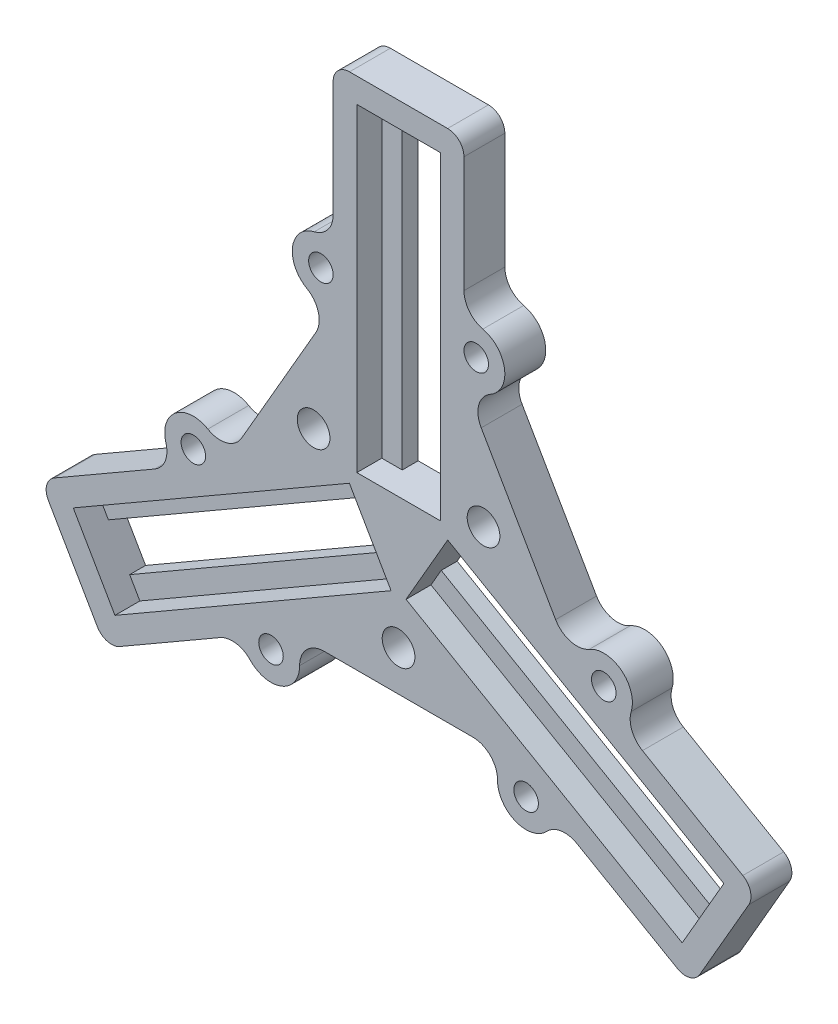
from build123d import *

# Parameters (mm, degrees)
SKETCH1_W           = 5.2
SKETCH1_H           = 39
BOSS_EXTRUDE1_DEPTH = 5
SKETCH2_W           = 10.2
SKETCH2_H           = 39
CUT_EXTRUDE1_DEPTH  = 3.05
CUT_EXTRUDE2_REACH  = 65.739
SKETCH3_R           = 2
SKETCH4_R           = 3.5
SKETCH4_R_2         = 1.5
BOSS_EXTRUDE2_DEPTH = 5
FILLET1_R           = 3
FILLET2_R           = 3
FILLET3_R           = 2


with BuildPart() as part:
    # Sketch1 → Boss-Extrude1 (new body)
    with BuildSketch(Plane.XY):
        Polygon((-8, 46), (8, 46), (8, 20), (21.320508076, -3.07179677), (43.837168574, -16.07179677), (35.837168574, -29.92820323), (13.320508076, -16.92820323), (-13.320508076, -16.92820323), (-35.837168574, -29.92820323), (-43.837168574, -16.07179677), (-21.320508076, -3.07179677), (-8, 20), align=None)
        Polygon((4.764101615, 0.25166605), (2.164101615, -4.25166605), (35.939092363, -23.75166605), (38.539092363, -19.24833395), align=None, mode=Mode.SUBTRACT)
        with Locations((0, 23.5)):
            Rectangle(SKETCH1_W, SKETCH1_H, mode=Mode.SUBTRACT)
        Polygon((-2.164101615, -4.25166605), (-4.764101615, 0.25166605), (-38.539092363, -19.24833395), (-35.939092363, -23.75166605), align=None, mode=Mode.SUBTRACT)
    extrude(amount=BOSS_EXTRUDE1_DEPTH)

    # Sketch2 → Cut-Extrude1 (cut)
    with BuildSketch(Plane.XY.offset(5)):
        with Locations((0, 23.5)):
            Rectangle(SKETCH2_W, SKETCH2_H)
        Polygon((39.789092363, -17.083270441), (34.689092363, -25.916729559), (0.914101615, -6.416729559), (6.014101615, 2.416729559), align=None)
        Polygon((-34.689092363, -25.916729559), (-39.789092363, -17.083270441), (-6.014101615, 2.416729559), (-0.914101615, -6.416729559), align=None)
    extrude(amount=-CUT_EXTRUDE1_DEPTH, mode=Mode.SUBTRACT)

    # Sketch3 → Cut-Extrude2 (cut, up to next)
    with BuildSketch(Plane.XY.offset(5), mode=Mode.PRIVATE) as cut_extrude2_sk1:
        with Locations((0, -12)):
            Circle(SKETCH3_R)
    cut_extrude2_tool1 = extrude(cut_extrude2_sk1.sketch, amount=-CUT_EXTRUDE2_REACH, mode=Mode.PRIVATE) & part.part
    # Sketch3 → Cut-Extrude2 (cut, up to next)
    with BuildSketch(Plane.XY.offset(5), mode=Mode.PRIVATE) as cut_extrude2_sk2:
        with Locations((-10.392304845, 6)):
            Circle(SKETCH3_R)
    cut_extrude2_tool2 = extrude(cut_extrude2_sk2.sketch, amount=-CUT_EXTRUDE2_REACH, mode=Mode.PRIVATE) & part.part
    # Sketch3 → Cut-Extrude2 (cut, up to next)
    with BuildSketch(Plane.XY.offset(5), mode=Mode.PRIVATE) as cut_extrude2_sk3:
        with Locations((10.392304845, 6)):
            Circle(SKETCH3_R)
    cut_extrude2_tool3 = extrude(cut_extrude2_sk3.sketch, amount=-CUT_EXTRUDE2_REACH, mode=Mode.PRIVATE) & part.part
    add(cut_extrude2_tool1.solids().sort_by_distance((0, -12, 5))[0], mode=Mode.SUBTRACT)
    add(cut_extrude2_tool2.solids().sort_by_distance((-10.392305, 6, 5))[0], mode=Mode.SUBTRACT)
    add(cut_extrude2_tool3.solids().sort_by_distance((10.392305, 6, 5))[0], mode=Mode.SUBTRACT)

    # Sketch4 → Boss-Extrude2 (add)
    # profile 1 of 6: a face of its own
    with BuildSketch(Plane.XY.offset(5)):
        with Locations((9.5, 23.5)):
            Circle(SKETCH4_R)
        with Locations((9.5, 23.5)):
            Circle(SKETCH4_R_2, mode=Mode.SUBTRACT)
    # profile 2 of 6: a face of its own
    with BuildSketch(Plane.XY.offset(5)):
        with Locations((-9.5, 23.5)):
            Circle(SKETCH4_R)
        with Locations((-9.5, 23.5)):
            Circle(SKETCH4_R_2, mode=Mode.SUBTRACT)
    # profile 3 of 6: a face of its own
    with BuildSketch(Plane.XY.offset(5)):
        with Locations((25.101596989, -3.522758664)):
            Circle(SKETCH4_R)
        with Locations((25.101596989, -3.522758664)):
            Circle(SKETCH4_R_2, mode=Mode.SUBTRACT)
    # profile 4 of 6: a face of its own
    with BuildSketch(Plane.XY.offset(5)):
        with Locations((15.601596989, -19.977241336)):
            Circle(SKETCH4_R)
        with Locations((15.601596989, -19.977241336)):
            Circle(SKETCH4_R_2, mode=Mode.SUBTRACT)
    # profile 5 of 6: a face of its own
    with BuildSketch(Plane.XY.offset(5)):
        with Locations((-15.601596989, -19.977241336)):
            Circle(SKETCH4_R)
        with Locations((-15.601596989, -19.977241336)):
            Circle(SKETCH4_R_2, mode=Mode.SUBTRACT)
    # profile 6 of 6: a face of its own
    with BuildSketch(Plane.XY.offset(5)):
        with Locations((-25.101596989, -3.522758664)):
            Circle(SKETCH4_R)
        with Locations((-25.101596989, -3.522758664)):
            Circle(SKETCH4_R_2, mode=Mode.SUBTRACT)
    extrude(amount=-BOSS_EXTRUDE2_DEPTH)

    # Fillet1
    # the kernel refuses this fillet: 3 mm, written as the material it adds along each edge
    with BuildSketch(Plane(origin=(8, 26.66227766, 0), x_dir=(0.9944903161976937, 0.10482848367219241, 0), z_dir=(0, 0, 1)), Plane(origin=(19.090209776, -20.25934206, 0), x_dir=(-0.40646102819849994, -0.9136681194809295, 0), z_dir=(0, 0, 1)), Plane(origin=(-27.090209776, -6.4029356, 0), x_dir=(-0.5880292879992107, 0.8088396358086942, 0), z_dir=(0, 0, 1))) as fillet1_piece_1:
        with BuildLine():
            CenterArc((3.314967721, 2.830369059), FILLET1_R, 173.982715136, 76.657636203)
            Line((0.331496772, 3.14485451), (0.271827353, 3.151144219))
            Line((0.271827353, 3.151144219), (-0.059669419, 0.006289709))
            Line((-0.059669419, 0.006289709), (0.019889806, -0.056607381))
            ThreePointArc((0.019889806, -0.056607381), (1.160238702, 0.137902764), (2.300587598, -0.056607381))
            Line((2.300587598, -0.056607381), (2.320477404, 0))
        make_face()
    extrude(amount=5)
    with BuildSketch(Plane(origin=(8, 20.33772234, 0), x_dir=(0, -1, 0), z_dir=(0, 0, 1)), Plane(origin=(13.612984201, -17.0970644, 0), x_dir=(-0.8660254037844379, 0.5000000000000013, 0), z_dir=(0, 0, 1)), Plane(origin=(-21.612984201, -3.24065794, 0), x_dir=(0.8660254037844385, 0.5000000000000004, 0), z_dir=(0, 0, 1))) as fillet1_piece_2:
        with BuildLine():
            CenterArc((3.27592086, 0.605796547), FILLET1_R, 172.092756849, 19.557213735)
            Line((0.30444462, 1.018505833), (0.245015095, 1.026760019))
            ThreePointArc((0.245015095, 1.026760019), (0.133629185, 0.514810643), (-0.054210474, 0.025714286))
            Line((-0.054210474, 0.025714286), (0, -0.06))
            ThreePointArc((0, -0.06), (0.16886117, -0.06), (0.278958369, -0.012115931))
            Line((0.278958369, -0.012115931), (0.33772234, 0))
        make_face()
    extrude(amount=5)
    with BuildSketch(Plane(origin=(-8, 20.33772234, 0), x_dir=(-0.9581124549425506, -0.2863922549301202, 0), z_dir=(0, 0, 1)), Plane(origin=(21.612984201, -3.24065794, 0), x_dir=(0.231033259254711, 0.9729458531275754, 0), z_dir=(0, 0, 1)), Plane(origin=(-13.612984201, -17.0970644, 0), x_dir=(0.7270791956878222, -0.6865535981975109, 0), z_dir=(0, 0, 1))) as fillet1_piece_3:
        with BuildLine():
            CenterArc((1.518619579, 2.965205138), FILLET1_R, 241.707941077, 19.557213735)
            Line((0.096721062, 0.32357598), (0.068283092, 0.270743397))
            ThreePointArc((0.068283092, 0.270743397), (-0.009126216, 0.178971525), (-0.057486747, 0.017183535))
            Line((-0.057486747, 0.017183535), (0.009111717, -0.059304103))
            ThreePointArc((0.009111717, -0.059304103), (0.531516853, -0.019405995), (1.053921988, -0.059304103))
            Line((1.053921988, -0.059304103), (1.063033705, 0))
        make_face()
    extrude(amount=5)
    with BuildSketch(Plane(origin=(-8, 26.66227766, 0), x_dir=(-0.9944903161976939, 0.10482848367219239, 0), z_dir=(0, 0, 1))) as fillet1_piece_4:
        with BuildLine():
            CenterArc((3.314967721, -2.830369059), FILLET1_R, 109.359648661, 76.657636203)
            Line((0.331496772, -3.14485451), (0.271827353, -3.151144219))
            Line((0.271827353, -3.151144219), (-0.059669419, -0.006289709))
            Line((-0.059669419, -0.006289709), (0.019889806, 0.056607381))
            ThreePointArc((0.019889806, 0.056607381), (1.160238702, -0.137902764), (2.300587598, 0.056607381))
            Line((2.300587598, 0.056607381), (2.320477404, 0))
        make_face()
    extrude(amount=5)
    with BuildSketch(Plane(origin=(27.090209776, -6.4029356, 0), x_dir=(0.8660254037844388, -0.4999999999999998, 0), z_dir=(0, 0, 1)), Plane(origin=(-19.090209776, -20.25934206, 0), x_dir=(-0.8660254037844379, -0.5000000000000012, 0), z_dir=(0, 0, 1))) as fillet1_piece_5:
        with BuildLine():
            CenterArc((3.16227766, 3), FILLET1_R, 193.342363797, 76.657636203)
            Line((0.243252128, 2.307692308), (0.184871617, 2.293846154))
            ThreePointArc((0.184871617, 2.293846154), (0.258769028, 1.139390016), (-0.054210474, 0.025714286))
            Line((-0.054210474, 0.025714286), (0, -0.06))
            Line((0, -0.06), (3.16227766, -0.06))
            Line((3.16227766, -0.06), (3.16227766, 0))
        make_face()
    extrude(amount=5)

    # Fillet2
    fillet2_edges = [part.edges().sort_by_distance(p)[0] for p in [
        (8, 20, 2.5),
    ]]
    fillet(fillet2_edges, radius=FILLET2_R)
    fillet2_2_edges = [part.edges().sort_by_distance(p)[0] for p in [
        (-13.320508076, -16.92820323, 2.5),
    ]]
    fillet(fillet2_2_edges, radius=FILLET2_R)
    fillet2_3_edges = [part.edges().sort_by_distance(p)[0] for p in [
        (13.320508076, -16.92820323, 2.5),
    ]]
    fillet(fillet2_3_edges, radius=FILLET2_R)
    fillet2_4_edges = [part.edges().sort_by_distance(p)[0] for p in [
        (-8, 20, 2.5),
    ]]
    fillet(fillet2_4_edges, radius=FILLET2_R)
    fillet2_5_edges = [part.edges().sort_by_distance(p)[0] for p in [
        (-21.320508076, -3.07179677, 2.5),
    ]]
    fillet(fillet2_5_edges, radius=FILLET2_R)
    fillet2_6_edges = [part.edges().sort_by_distance(p)[0] for p in [
        (21.320508076, -3.07179677, 2.5),
    ]]
    fillet(fillet2_6_edges, radius=FILLET2_R)

    # Fillet3
    fillet3_edges = [part.edges().sort_by_distance(p)[0] for p in [
        (43.837168574, -16.07179677, 2.5),
        (35.837168574, -29.92820323, 2.5),
        (-35.837168574, -29.92820323, 2.5),
        (-43.837168574, -16.07179677, 2.5),
        (-8, 46, 2.5),
        (8, 46, 2.5),
    ]]
    fillet(fillet3_edges, radius=FILLET3_R)


solid = part.part
